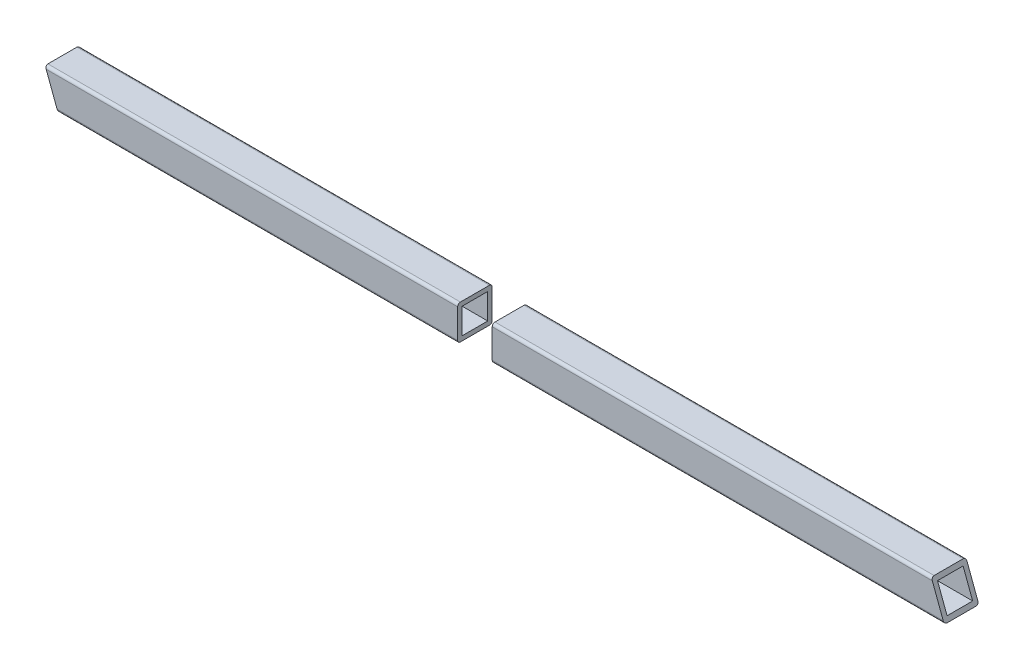
from build123d import *

# Parameters (mm, degrees)
SKETCH1_W           = 23.495
SKETCH1_H           = 23.495
BOSS_EXTRUDE1_DEPTH = 393.7
SCALE1_SCALE_X      = 1
SCALE1_SCALE_Y      = 0.4
SCALE1_SCALE_Z      = 0.4
SKETCH5_W           = 12.7
SKETCH5_H           = 12.7
CUT_EXTRUDE3_DEPTH  = 395.531279762


with BuildPart() as part:
    # Sketch1 → Boss-Extrude1 (new body)
    with BuildSketch(Plane(origin=(0, 0, 0), x_dir=(0, 0, -1), z_dir=(1, 0, 0))):
        with BuildLine():
            Line((0, 2.54), (0, 29.21))
            ThreePointArc((0, 29.21), (-0.743948776, 31.006051224), (-2.54, 31.75))
            Line((-2.54, 31.75), (-29.21, 31.75))
            ThreePointArc((-29.21, 31.75), (-31.006051224, 31.006051224), (-31.75, 29.21))
            Line((-31.75, 29.21), (-31.75, 2.54))
            ThreePointArc((-31.75, 2.54), (-31.006051224, 0.743948776), (-29.21, 0))
            Line((-29.21, 0), (-2.54, 0))
            ThreePointArc((-2.54, 0), (-0.743948776, 0.743948776), (0, 2.54))
        make_face()
        with Locations((-15.875, 15.875)):
            Rectangle(SKETCH1_W, SKETCH1_H, mode=Mode.SUBTRACT)
    extrude(amount=BOSS_EXTRUDE1_DEPTH)


with BuildPart() as part_1:
    # Scale1: scaled about (196.85, 15.875, 15.875)
    add(part.part.scale((SCALE1_SCALE_X, SCALE1_SCALE_Y, SCALE1_SCALE_Z), about=(196.85, 15.875, 15.875)))

    # Sketch5 → Cut-Extrude3 (cut, through all)
    with BuildSketch(Plane(origin=(0, 0, 9.525), x_dir=(-1, 0, 0), z_dir=(0, 0, -1))):
        with Locations((-157.8115123, 15.875)):
            Rectangle(SKETCH5_W, SKETCH5_H)
        Polygon((0, 22.225), (-4.746677741, 9.525), (0, 9.525), align=None)
        Polygon((-330.140081109, 9.525), (-325.393403368, 22.225), (-353.752502661, 22.225), (-358.499180402, 9.525), align=None)
    extrude(amount=-CUT_EXTRUDE3_DEPTH, mode=Mode.SUBTRACT)


with BuildPart() as cut_extrude3_piece_1:
    # of the separate pieces the step leaves, piece 1, a body of its own (cut_extrude3_pieces_kept)
    add(part_1.part.solids().sort_by_distance((164.1615123, 21.209, 9.525))[0])


with BuildPart() as cut_extrude3_piece_2:
    # of the separate pieces the step leaves, piece 2, a body of its own (cut_extrude3_pieces_kept)
    add(part_1.part.solids().sort_by_distance((0.379734219, 21.209, 9.525))[0])


solid = Compound([cut_extrude3_piece_1.part, cut_extrude3_piece_2.part])
